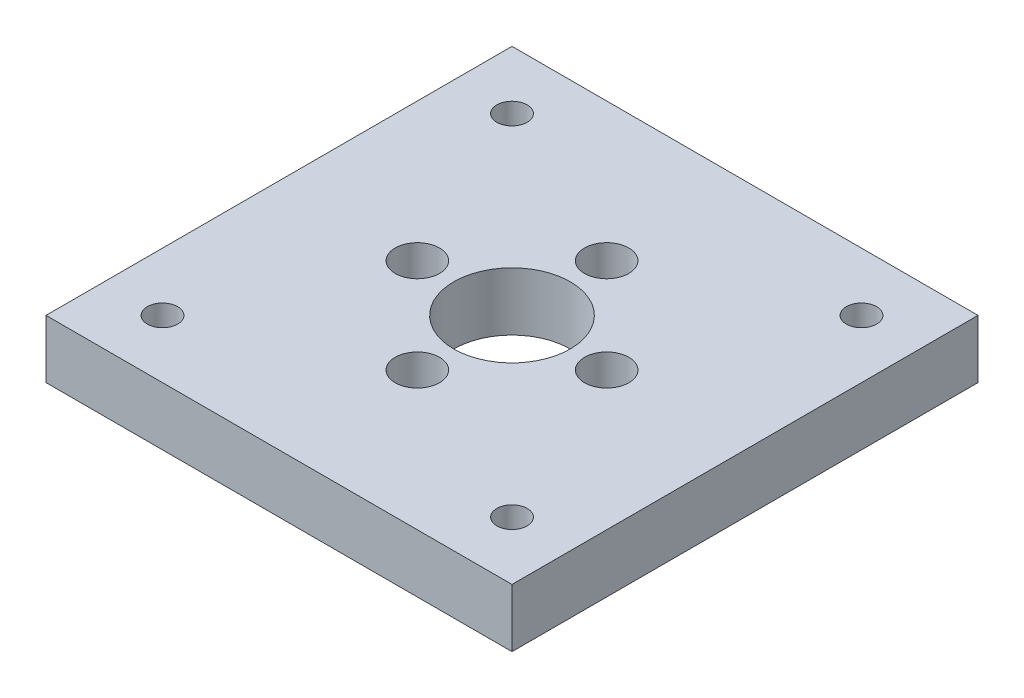
from build123d import *

# Parameters (mm, degrees)
SKETCH1_W           = 101.6
SKETCH1_H           = 101.6
SKETCH1_R           = 3.302
SKETCH1_R_2         = 12.7
SKETCH1_R_3         = 4.826
BOSS_EXTRUDE1_DEPTH = 6.35


with BuildPart() as part:
    # Sketch1 → Boss-Extrude1 (new, symmetric)
    with BuildSketch(Plane(origin=(0, 0, 0), x_dir=(1, 0, 0), z_dir=(0, 1, 0))):
        Rectangle(SKETCH1_W, SKETCH1_H)
        with Locations((-38.1, 38.1)):
            Circle(SKETCH1_R, mode=Mode.SUBTRACT)
        with Locations((-38.1, -38.1)):
            Circle(SKETCH1_R, mode=Mode.SUBTRACT)
        with Locations((38.1, -38.1)):
            Circle(SKETCH1_R, mode=Mode.SUBTRACT)
        with Locations((38.1, 38.1)):
            Circle(SKETCH1_R, mode=Mode.SUBTRACT)
        Circle(SKETCH1_R_2, mode=Mode.SUBTRACT)
        with Locations((0, 20.6375)):
            Circle(SKETCH1_R_3, mode=Mode.SUBTRACT)
        with Locations((0, -20.6375)):
            Circle(SKETCH1_R_3, mode=Mode.SUBTRACT)
        with Locations((-20.6375, 0)):
            Circle(SKETCH1_R_3, mode=Mode.SUBTRACT)
        with Locations((20.6375, 0)):
            Circle(SKETCH1_R_3, mode=Mode.SUBTRACT)
    extrude(amount=BOSS_EXTRUDE1_DEPTH, both=True)


solid = part.part
